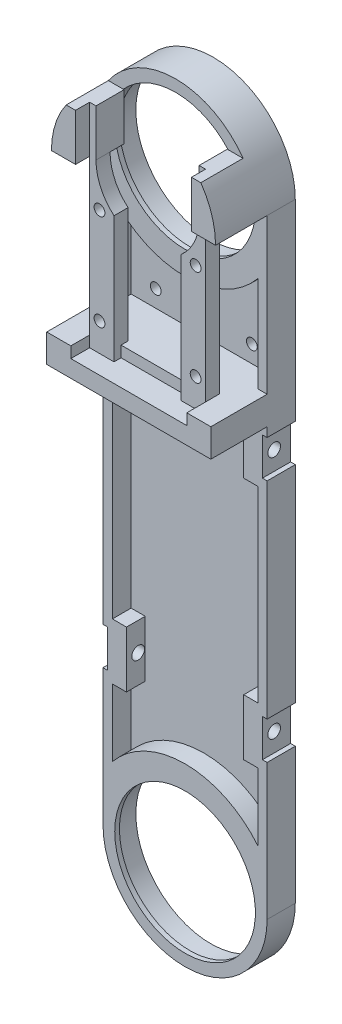
from build123d import *
from OCP.BRepFilletAPI import BRepFilletAPI_MakeChamfer

# Parameters (mm, degrees)
EXTRUDE_1_DEPTH      = 6
SKETCH_2_R           = 16
CUT_EXTRUDE_1_DEPTH  = 5
CHAMFER_1_SIZE       = 0.5
CHAMFER_1_SIZE2      = 1.025151921
SKETCH_24_R          = 15
CUT_EXTRUDE_15_DEPTH = 149.618639477
CUT_EXTRUDE_16_DEPTH = 4
SKETCH_26_W          = 1
SKETCH_26_H          = 8
CUT_EXTRUDE_17_DEPTH = 149.655642342
SKETCH_27_R          = 1.35
CUT_EXTRUDE_18_DEPTH = 152.486798105
SKETCH_29_W          = 35
SKETCH_29_H          = 6
EXTRUDE_3_DEPTH      = 12
EXTRUDE_4_DEPTH      = 2
EXTRUDE_5_DEPTH      = 9
SKETCH_32_W          = 24.73
SKETCH_32_H          = 50
CUT_EXTRUDE_19_DEPTH = 4
SKETCH_33_W          = 14.3
SKETCH_33_H          = 2.35
CUT_EXTRUDE_20_DEPTH = 1.5
EXTRUDE_6_REACH      = 119.22
SKETCH_34_W          = 5.215
SKETCH_34_H          = 3
CUT_EXTRUDE_START    = -6
CUT_EXTRUDE_21_DEPTH = 6
SKETCH_36_R          = 1.15
CUT_EXTRUDE_22_DEPTH = 150.192828246


with BuildPart() as part:
    # 스케치1 → 보스-돌출1 (new body)
    with BuildSketch(Plane.XY):
        with BuildLine():
            Line((-17.5, 0), (-17.5, 130))
            ThreePointArc((-17.5, 130), (0, 147.5), (17.5, 130))
            Line((17.5, 130), (17.5, 0))
            ThreePointArc((17.5, 0), (0, -17.5), (-17.5, 0))
        make_face()
    extrude(amount=EXTRUDE_1_DEPTH)

    # 스케치2 → 컷-돌출1 (cut)
    with BuildSketch(Plane(origin=(0, 0, 0), x_dir=(-1, 0, 0), z_dir=(0, 0, -1))):
        Circle(SKETCH_2_R)
        with Locations((0, 130)):
            Circle(SKETCH_2_R)
    extrude(amount=-CUT_EXTRUDE_1_DEPTH, mode=Mode.SUBTRACT)

    # 모따기1: one chamfer whose edges measure the first distance from different faces: ONE call of the kernel's chamfer builder (chamfer() names one face for all edges)
    chamfer_1_edges_1 = [part.edges().sort_by_distance(p)[0] for p in [
        (16, 130, 0),
    ]]
    chamfer_1_side_1 = [part.faces().sort_by_distance(p)[0] for p in [
        (16, 130, 2.5),
    ]]
    chamfer_1_edges_2 = [part.edges().sort_by_distance(p)[0] for p in [
        (16, 0, 0),
    ]]
    chamfer_1_side_2 = [part.faces().sort_by_distance(p)[0] for p in [
        (16, 0, 2.5),
    ]]
    chamfer_1 = BRepFilletAPI_MakeChamfer(part.part.solid().wrapped)
    for e in chamfer_1_edges_1:
        chamfer_1.Add(CHAMFER_1_SIZE, CHAMFER_1_SIZE2, e.wrapped, chamfer_1_side_1[0].wrapped)  # the first distance lies on this face
    for e in chamfer_1_edges_2:
        chamfer_1.Add(CHAMFER_1_SIZE, CHAMFER_1_SIZE2, e.wrapped, chamfer_1_side_2[0].wrapped)  # the first distance lies on this face
    add(Compound.cast(chamfer_1.Shape()), mode=Mode.REPLACE)

    # 스케치24 → 컷-돌출15 (cut, through all)
    with BuildSketch(Plane(origin=(0, 0, 5), x_dir=(-1, 0, 0), z_dir=(0, 0, -1))):
        with Locations((0, 130)):
            Circle(SKETCH_24_R)
        Circle(SKETCH_24_R)
    extrude(amount=-CUT_EXTRUDE_15_DEPTH, mode=Mode.SUBTRACT)

    # 스케치25 → 컷-돌출16 (cut)
    with BuildSketch(Plane.XY.offset(6)):
        with BuildLine():
            Line((-15.5, 12.63922466), (-15.5, 27))
            Line((-15.5, 27), (-12.5, 27))
            Line((-12.5, 27), (-12.5, 39))
            Line((-12.5, 39), (-15.5, 39))
            Line((-15.5, 39), (-15.5, 79))
            Line((-15.5, 79), (-12.5, 79))
            Line((-12.5, 79), (-12.5, 91))
            Line((-12.5, 91), (12.5, 91))
            Line((12.5, 91), (12.5, 79))
            Line((12.5, 79), (15.5, 79))
            Line((15.5, 79), (15.5, 39))
            Line((15.5, 39), (12.5, 39))
            Line((12.5, 39), (12.5, 27))
            Line((12.5, 27), (15.5, 27))
            Line((15.5, 27), (15.5, 12.63922466))
            ThreePointArc((15.5, 12.63922466), (0, 20), (-15.5, 12.63922466))
        make_face()
        with BuildLine():
            Line((-15.5, 97), (15.5, 97))
            Line((15.5, 97), (15.5, 117.36077534))
            ThreePointArc((15.5, 117.36077534), (0, 110), (-15.5, 117.36077534))
            Line((-15.5, 117.36077534), (-15.5, 97))
        make_face()
    extrude(amount=-CUT_EXTRUDE_16_DEPTH, mode=Mode.SUBTRACT)

    # 스케치26 → 컷-돌출17 (cut, through all)
    with BuildSketch(Plane.XY.offset(6)):
        with Locations((-17, 85)):
            Rectangle(SKETCH_26_W, SKETCH_26_H)
        with Locations((17, 85)):
            Rectangle(SKETCH_26_W, SKETCH_26_H)
        with Locations((-17, 33)):
            Rectangle(SKETCH_26_W, SKETCH_26_H)
        with Locations((17, 33)):
            Rectangle(SKETCH_26_W, SKETCH_26_H)
    extrude(amount=-CUT_EXTRUDE_17_DEPTH, mode=Mode.SUBTRACT)

    # 스케치27 → 컷-돌출18 (cut, through all)
    with BuildSketch(Plane.ZY.offset(16.5)):
        with Locations((3.5, 85)):
            Circle(SKETCH_27_R)
        with Locations((3.5, 33)):
            Circle(SKETCH_27_R)
    extrude(amount=-CUT_EXTRUDE_18_DEPTH, mode=Mode.SUBTRACT)

    # 스케치29 → 보스-돌출3 (add)
    with BuildSketch(Plane.XY.offset(6)):
        with Locations((0, 94)):
            Rectangle(SKETCH_29_W, SKETCH_29_H)
    extrude(amount=EXTRUDE_3_DEPTH)

    # 스케치30 → 보스-돌출4 (add)
    with BuildSketch(Plane.XY.offset(6)):
        with BuildLine():
            Line((-17.5, 130), (-15, 130))
            ThreePointArc((-15, 130), (0, 145), (15, 130))
            Line((15, 130), (17.5, 130))
            ThreePointArc((17.5, 130), (0, 147.5), (-17.5, 130))
        make_face()
    extrude(amount=EXTRUDE_4_DEPTH)

    # 스케치31 → 보스-돌출5 (add)
    with BuildSketch(Plane.XY.offset(8)):
        with BuildLine():
            Line((-17.5, 130), (-11, 130))
            ThreePointArc((-11, 130), (-9.257654472, 135.941029682), (-4.582575695, 140))
            Line((-4.582575695, 140), (-14.361406616, 140))
            ThreePointArc((-14.361406616, 140), (-16.696925103, 135.240485866), (-17.5, 130))
        make_face()
        with BuildLine():
            Line((11, 130), (17.5, 130))
            ThreePointArc((17.5, 130), (16.696925103, 135.240485866), (14.361406616, 140))
            Line((14.361406616, 140), (4.582575695, 140))
            ThreePointArc((4.582575695, 140), (9.257654472, 135.941029682), (11, 130))
        make_face()
    extrude(amount=EXTRUDE_5_DEPTH)

    # 스케치32 → 컷-돌출19 (cut)
    with BuildSketch(Plane.XY.offset(18)):
        with Locations((0, 119.65)):
            Rectangle(SKETCH_32_W, SKETCH_32_H)
    extrude(amount=-CUT_EXTRUDE_19_DEPTH, mode=Mode.SUBTRACT)

    # 스케치33 → 컷-돌출20 (cut)
    with BuildSketch(Plane.XY.offset(14)):
        with Locations((0, 95.825)):
            Rectangle(SKETCH_33_W, SKETCH_33_H)
    extrude(amount=-CUT_EXTRUDE_20_DEPTH, mode=Mode.SUBTRACT)

    # 스케치34 → 보스-돌출6 (add, up to next)
    with BuildSketch(Plane(origin=(0, 97, 0), x_dir=(1, 0, 0), z_dir=(0, 1, 0)), mode=Mode.PRIVATE) as extrude_6_sk1:
        with Locations((-9.7575, -12.5)):
            Rectangle(SKETCH_34_W, SKETCH_34_H)
    extrude_6_tool1 = extrude(extrude_6_sk1.sketch, amount=EXTRUDE_6_REACH, mode=Mode.PRIVATE) - part.part
    # 스케치34 → 보스-돌출6 (add, up to next)
    with BuildSketch(Plane(origin=(0, 97, 0), x_dir=(1, 0, 0), z_dir=(0, 1, 0)), mode=Mode.PRIVATE) as extrude_6_sk2:
        with Locations((9.7575, -12.5)):
            Rectangle(SKETCH_34_W, SKETCH_34_H)
    extrude_6_tool2 = extrude(extrude_6_sk2.sketch, amount=EXTRUDE_6_REACH, mode=Mode.PRIVATE) - part.part
    add(extrude_6_tool1.solids().sort_by_distance((-9.7575, 97, 12.5))[0])
    add(extrude_6_tool2.solids().sort_by_distance((9.7575, 97, 12.5))[0])

    # 스케치35 → 컷-돌출21 (cut)
    with BuildSketch(Plane.XY.offset(14).offset(CUT_EXTRUDE_START)):
        with BuildLine():
            Line((-11, 130), (-11, 140))
            Line((-11, 140), (11, 140))
            Line((11, 140), (11, 130))
            ThreePointArc((11, 130), (0, 119), (-11, 130))
        make_face()
    extrude(amount=CUT_EXTRUDE_21_DEPTH, mode=Mode.SUBTRACT)

    # 스케치36 → 컷-돌출22 (cut, through all)
    with BuildSketch(Plane.XY.offset(14)):
        with Locations((-10.25, 121.15)):
            Circle(SKETCH_36_R)
        with Locations((10.25, 121.15)):
            Circle(SKETCH_36_R)
        with Locations((-10.25, 100.65)):
            Circle(SKETCH_36_R)
        with Locations((10.25, 100.65)):
            Circle(SKETCH_36_R)
    extrude(amount=-CUT_EXTRUDE_22_DEPTH, mode=Mode.SUBTRACT)


solid = part.part
